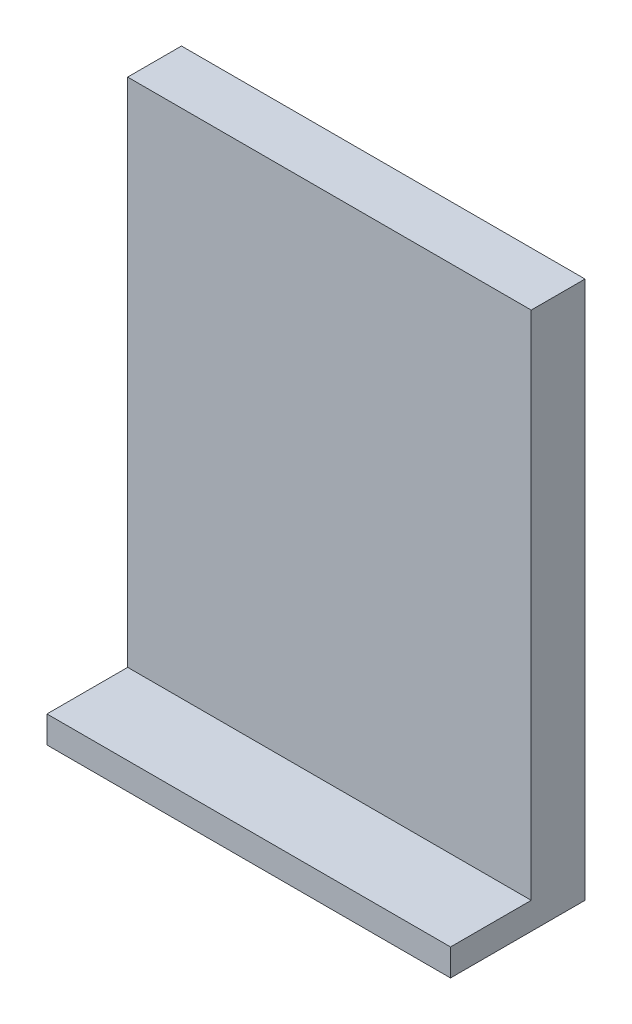
from build123d import *

# Parameters (mm, degrees)
SKETCH1_W           = 15
SKETCH1_H           = 20
BOSS_EXTRUDE1_DEPTH = 2
SKETCH3_W           = 15
SKETCH3_H           = 1
BOSS_EXTRUDE2_DEPTH = 3


with BuildPart() as part:
    # Sketch1 → Boss-Extrude1 (new body)
    with BuildSketch(Plane.XY):
        with Locations((19.046366178, 7.872042723)):
            Rectangle(SKETCH1_W, SKETCH1_H)
    extrude(amount=BOSS_EXTRUDE1_DEPTH)

    # Sketch3 → Boss-Extrude2 (add)
    with BuildSketch(Plane.XY.offset(2)):
        with Locations((19.046366178, -1.627957277)):
            Rectangle(SKETCH3_W, SKETCH3_H)
    extrude(amount=BOSS_EXTRUDE2_DEPTH)


solid = part.part
